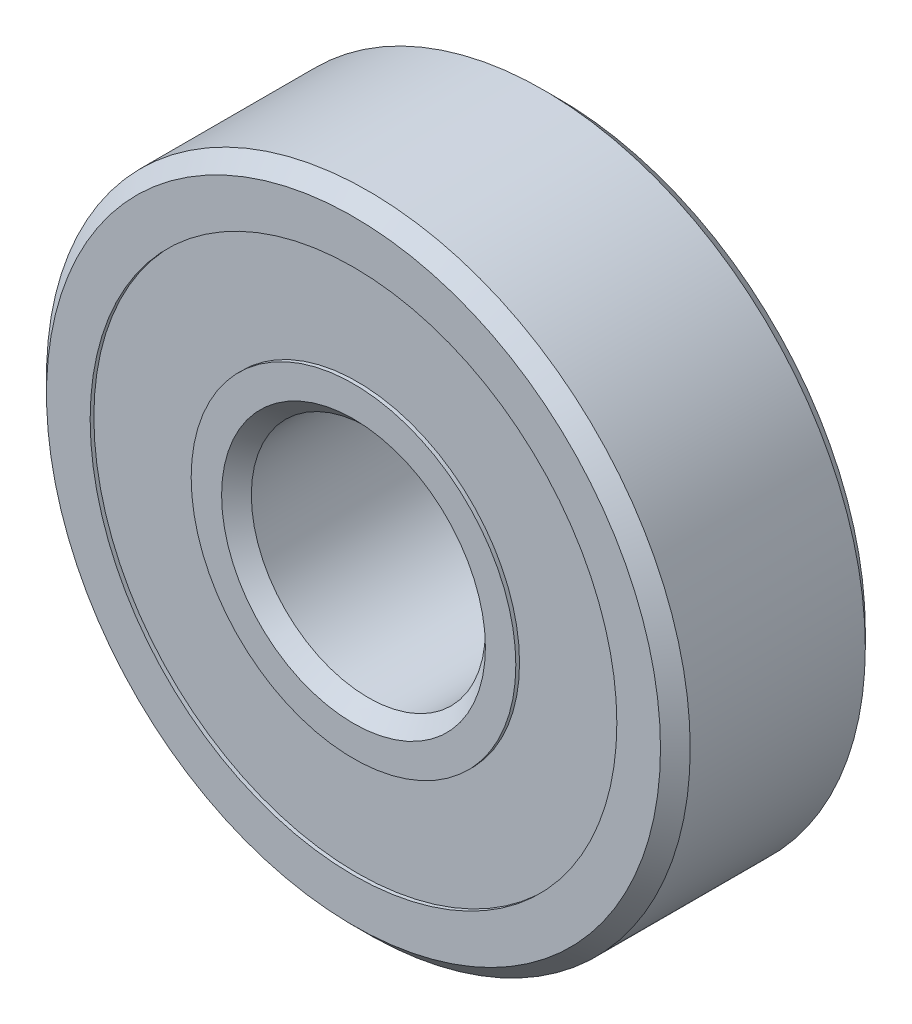
from build123d import *

# Parameters (mm, degrees)
SKETCH1_R           = 11
SKETCH1_R_2         = 4
BOSS_EXTRUDE1_DEPTH = 7
CHAMFER1_SIZE       = 0.508
SKETCH2_R           = 9.000130234
SKETCH2_R_2         = 5.547634914
CUT_EXTRUDE1_DEPTH  = 0.127


with BuildPart() as part:
    # Sketch1 → Boss-Extrude1 (new body)
    with BuildSketch(Plane.XY):
        Circle(SKETCH1_R)
        Circle(SKETCH1_R_2, mode=Mode.SUBTRACT)
    extrude(amount=BOSS_EXTRUDE1_DEPTH)

    # Chamfer1
    chamfer1_edges = [part.edges().sort_by_distance(p)[0] for p in [
        (-11, 0, 0),
        (-4, 0, 7),
        (-11, 0, 7),
    ]]
    chamfer(chamfer1_edges, length=CHAMFER1_SIZE)

    # Sketch2 → Cut-Extrude1 (cut)
    with BuildSketch(Plane(origin=(0, 0, 0), x_dir=(-1, 0, 0), z_dir=(0, 0, -1))):
        Circle(SKETCH2_R)
        Circle(SKETCH2_R_2, mode=Mode.SUBTRACT)
    cut_extrude1 = extrude(amount=-CUT_EXTRUDE1_DEPTH, mode=Mode.SUBTRACT)

    # Mirror1: Cut-Extrude1 across plane
    add(cut_extrude1.mirror(Plane(origin=(0, 0, 3.5), x_dir=(1, 0, 0), z_dir=(0, 0, -1))), mode=Mode.SUBTRACT)


solid = part.part
